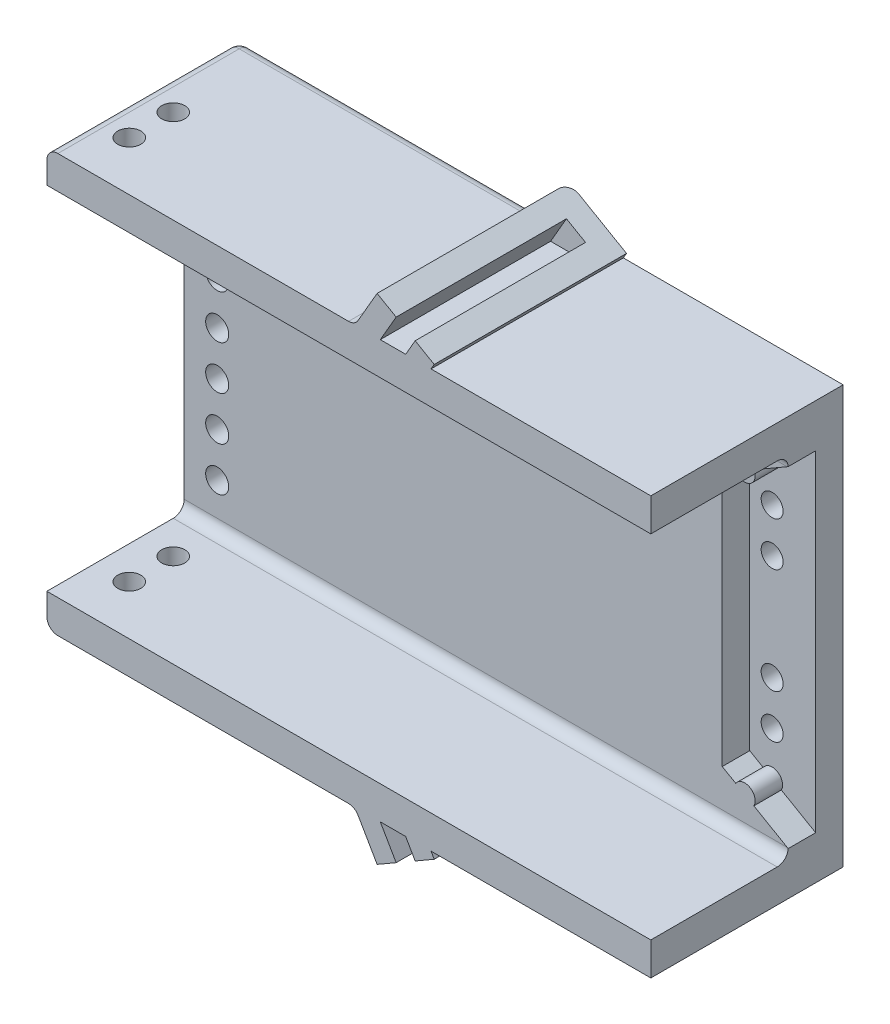
from build123d import *

# Parameters (mm, degrees)
SKETCH_2_W               = 109.92
SKETCH_2_H               = 76
EXTRUDE_1_DEPTH          = 10
CUT_EXTRUDE_1_DEPTH      = 5
SKETCH_4_R               = 2
CUT_EXTRUDE_2_DEPTH      = 92.808295873
SKETCH_5_W               = 109.92
SKETCH_5_H               = 6
EXTRUDE_2_DEPTH          = 25
CUT_EXTRUDE_3_DEPTH      = 104.340627651
CUT_EXTRUDE_3_DEPTH_BACK = 104.340627651
SKETCH_7_R               = 2.1
SKETCH_9_R               = 2.1
CUT_EXTRUDE_4_DEPTH      = 96.019804204
CUT_EXTRUDE_5_DEPTH      = 5
EXTRUDE_3_DEPTH          = 35
FILLET_1_R               = 2
EXTRUDE_4_DEPTH          = 4


with BuildPart() as part:
    # 草圖2 → 填料-伸長1 (new body)
    with BuildSketch(Plane.XY):
        with Locations((12.52544527, 24.044160626)):
            Rectangle(SKETCH_2_W, SKETCH_2_H)
    extrude(amount=EXTRUDE_1_DEPTH)

    # 草圖3 → 除料-伸長1 (cut)
    with BuildSketch(Plane.XY.offset(10)):
        with BuildLine():
            Line((67.48544527, -6.055839374), (67.48544527, 54.144160626))
            Line((67.48544527, 54.144160626), (61.24181631, 50.538464901))
            ThreePointArc((61.24181631, 50.538464901), (61.408690367, 50.105080914), (61.46544527, 49.644160626))
            ThreePointArc((61.46544527, 49.644160626), (60.088104264, 47.81746208), (57.95299519, 48.639170705))
            Line((57.95299519, 48.639170705), (55.48544527, 47.214160626))
            Line((55.48544527, 47.214160626), (55.48544527, 0.874160626))
            Line((55.48544527, 0.874160626), (57.95299519, -0.550849453))
            ThreePointArc((57.95299519, -0.550849453), (60.088104264, 0.270859171), (61.46544527, -1.555839374))
            ThreePointArc((61.46544527, -1.555839374), (61.408690367, -2.016759663), (61.24181631, -2.45014365))
            Line((61.24181631, -2.45014365), (67.48544527, -6.055839374))
        make_face()
    extrude(amount=-CUT_EXTRUDE_1_DEPTH, mode=Mode.SUBTRACT)

    # 草圖4 → 除料-伸長2 (cut, through all)
    with BuildSketch(Plane.XY.offset(5)):
        with Locations((59.56544527, 41.644160626)):
            Circle(SKETCH_4_R)
        with Locations((59.56544527, 33.644160626)):
            Circle(SKETCH_4_R)
        with Locations((59.56544527, 6.444160626)):
            Circle(SKETCH_4_R)
        with Locations((59.56544527, 14.444160626)):
            Circle(SKETCH_4_R)
    extrude(amount=-CUT_EXTRUDE_2_DEPTH, mode=Mode.SUBTRACT)

    # 草圖5 → 填料-伸長2 (add)
    with BuildSketch(Plane.XY.offset(10)):
        with Locations((12.52544527, -10.955839374)):
            Rectangle(SKETCH_5_W, SKETCH_5_H)
        with Locations((12.52544527, 59.044160626)):
            Rectangle(SKETCH_5_W, SKETCH_5_H)
    extrude(amount=EXTRUDE_2_DEPTH)

    # 草圖7 → 除料-伸長3 (cut, two sides: drawn at the far end of the back side and taken through both)
    with BuildSketch(Plane(origin=(0, -7.955839374, 0), x_dir=(1, 0, 0), z_dir=(0, 1, 0)).offset(-CUT_EXTRUDE_3_DEPTH_BACK)):
        with Locations(Location((-36.43455473, -18, 0), (0, 0, 270))):
            Circle(SKETCH_7_R)
        with Locations(Location((-36.43455473, -26, 0), (0, 0, 270))):
            Circle(SKETCH_7_R)
    extrude(amount=CUT_EXTRUDE_3_DEPTH + CUT_EXTRUDE_3_DEPTH_BACK, mode=Mode.SUBTRACT)

    # 草圖9 → 除料-伸長4 (cut, through all)
    with BuildSketch(Plane.XY.offset(10)):
        with Locations((-36.43455473, 0.044160626)):
            Circle(SKETCH_9_R)
        with Locations((-36.43455473, 8.044160626)):
            Circle(SKETCH_9_R)
        with Locations((-36.43455473, 16.044160626)):
            Circle(SKETCH_9_R)
        with Locations((-36.43455473, 24.044160626)):
            Circle(SKETCH_9_R)
        with Locations((-36.43455473, 32.044160626)):
            Circle(SKETCH_9_R)
        with Locations((-36.43455473, 40.044160626)):
            Circle(SKETCH_9_R)
        with Locations((-36.43455473, 48.044160626)):
            Circle(SKETCH_9_R)
    extrude(amount=-CUT_EXTRUDE_4_DEPTH, mode=Mode.SUBTRACT)

    # 草圖10 → 除料-伸長5 (cut)
    with BuildSketch(Plane(origin=(0, 0, 0), x_dir=(-1, 0, 0), z_dir=(0, 0, -1))):
        with BuildLine():
            Line((32.43455473, 0.044160626), (32.43455473, 48.044160626))
            ThreePointArc((32.43455473, 48.044160626), (36.43455473, 52.044160626), (40.43455473, 48.044160626))
            Line((40.43455473, 48.044160626), (40.43455473, 0.044160626))
            ThreePointArc((40.43455473, 0.044160626), (36.43455473, -3.955839374), (32.43455473, 0.044160626))
        make_face()
    extrude(amount=-CUT_EXTRUDE_5_DEPTH, mode=Mode.SUBTRACT)

    # 草圖12 → 填料-伸長3 (add)
    with BuildSketch(Plane.XY.offset(35)):
        Polygon((17.670490694, 69.044160626), (13.629038809, 62.044160626), (18.247840963, 62.044160626), (21.134592309, 67.044160626), align=None)
        Polygon((24.598693924, 65.044160626), (22.866643116, 62.044160626), (27.48544527, 62.044160626), (28.062795539, 63.044160626), align=None)
        Polygon((18.247840963, -13.955839374), (13.629038809, -13.955839374), (17.670490694, -20.955839374), (21.134592309, -18.955839374), align=None)
        Polygon((27.48544527, -13.955839374), (22.866643116, -13.955839374), (24.598693924, -16.955839374), (28.062795539, -14.955839374), align=None)
    extrude(amount=-EXTRUDE_3_DEPTH)

    # 圓角1
    fillet_1_edges = [part.edges().sort_by_distance(p)[0] for p in [
        (12.52544527, 56.044160626, 10),
        (12.52544527, -7.955839374, 10),
        (-42.43455473, 62.044160626, 17.5),
        (-42.43455473, -13.955839374, 17.5),
        (-42.43455473, 24.044160626, 0),
        (-14.40275796, -13.955839374, 0),
        (15.649764752, -17.455839374, 0),
        (15.649764752, 65.544160626, 0),
        (13.629038809, -13.955839374, 17.5),
        (13.629038809, 62.044160626, 17.5),
        (-14.40275796, 62.044160626, 0),
    ]]
    fillet(fillet_1_edges, radius=FILLET_1_R - 0.0001)  # a hair under: the kernel refuses the full size

    # 草圖13 → 填料-伸長4 (add)
    with BuildSketch(Plane(origin=(0, 0, 0), x_dir=(-1, 0, 0), z_dir=(0, 0, -1))):
        Polygon((-21.134592309, -18.955839374), (-24.598693924, -16.955839374), (-22.866643116, -13.955839374), (-18.247840963, -13.955839374), align=None)
        Polygon((-22.866643116, 62.044160626), (-24.598693924, 65.044160626), (-21.134592309, 67.044160626), (-18.247840963, 62.044160626), align=None)
    extrude(amount=-EXTRUDE_4_DEPTH)


solid = part.part
